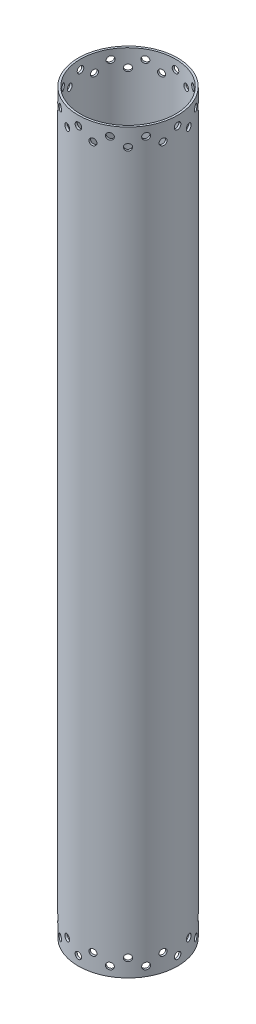
from build123d import *

# Parameters (mm, degrees)
SKETCH2_R                = 76.2
SKETCH2_R_2              = 73.025
BOSS_EXTRUDE1_DEPTH      = 1130.3
SKETCH3_R                = 5.0419
CUT_EXTRUDE1_DEPTH       = 1143
SKETCH6_R                = 5.0419
CUT_EXTRUDE2_DEPTH       = 25.4
CIRPATTERN2_COUNT        = 12
MIRROR1_COPY_1_SKETCH_R  = 5.0419
MIRROR1_COPY_1_DEPTH     = 1143
MIRROR1_COPY_2_SKETCH_R  = 5.0419
MIRROR1_COPY_2_DEPTH     = 1143
MIRROR1_COPY_3_SKETCH_R  = 5.0419
MIRROR1_COPY_3_DEPTH     = 1143
MIRROR1_COPY_4_SKETCH_R  = 5.0419
MIRROR1_COPY_4_DEPTH     = 1143
MIRROR1_COPY_5_SKETCH_R  = 5.0419
MIRROR1_COPY_5_DEPTH     = 1143
MIRROR1_COPY_6_SKETCH_R  = 5.0419
MIRROR1_COPY_6_DEPTH     = 1143
MIRROR1_COPY_7_SKETCH_R  = 5.0419
MIRROR1_COPY_7_DEPTH     = 1143
MIRROR1_COPY_8_SKETCH_R  = 5.0419
MIRROR1_COPY_8_DEPTH     = 1143
MIRROR1_COPY_9_SKETCH_R  = 5.0419
MIRROR1_COPY_9_DEPTH     = 1143
MIRROR1_COPY_10_SKETCH_R = 5.0419
MIRROR1_COPY_10_DEPTH    = 1143
MIRROR1_COPY_11_SKETCH_R = 5.0419
MIRROR1_COPY_11_DEPTH    = 1143
MIRROR1_COPY_12_SKETCH_R = 5.0419
MIRROR1_COPY_12_DEPTH    = 25.4
MIRROR1_COPY_13_SKETCH_R = 5.0419
MIRROR1_COPY_13_DEPTH    = 25.4
MIRROR1_COPY_14_SKETCH_R = 5.0419
MIRROR1_COPY_14_DEPTH    = 25.4
MIRROR1_COPY_15_SKETCH_R = 5.0419
MIRROR1_COPY_15_DEPTH    = 25.4
MIRROR1_COPY_16_SKETCH_R = 5.0419
MIRROR1_COPY_16_DEPTH    = 25.4
MIRROR1_COPY_17_SKETCH_R = 5.0419
MIRROR1_COPY_17_DEPTH    = 25.4
MIRROR1_COPY_18_SKETCH_R = 5.0419
MIRROR1_COPY_18_DEPTH    = 25.4
MIRROR1_COPY_19_SKETCH_R = 5.0419
MIRROR1_COPY_19_DEPTH    = 25.4
MIRROR1_COPY_20_SKETCH_R = 5.0419
MIRROR1_COPY_20_DEPTH    = 25.4
MIRROR1_COPY_21_SKETCH_R = 5.0419
MIRROR1_COPY_21_DEPTH    = 25.4
MIRROR1_COPY_22_SKETCH_R = 5.0419
MIRROR1_COPY_22_DEPTH    = 25.4
MIRROR1_COPY_23_SKETCH_R = 5.0419
MIRROR1_COPY_23_DEPTH    = 1143
MIRROR1_COPY_24_SKETCH_R = 5.0419
MIRROR1_COPY_24_DEPTH    = 25.4


with BuildPart() as part:
    # Sketch2 → Boss-Extrude1 (new body)
    with BuildSketch(Plane(origin=(0, 0, 0), x_dir=(1, 0, 0), z_dir=(0, 1, 0))):
        Circle(SKETCH2_R)
        Circle(SKETCH2_R_2, mode=Mode.SUBTRACT)
    extrude(amount=BOSS_EXTRUDE1_DEPTH)

    # Sketch3 → Cut-Extrude1 (cut)
    with BuildSketch(Plane.XY):
        with Locations((0, 1116.203)):
            Circle(SKETCH3_R)
    cut_extrude1 = extrude(amount=-CUT_EXTRUDE1_DEPTH, mode=Mode.SUBTRACT)

    # Sketch6 → Cut-Extrude2 (cut)
    with BuildSketch(Plane(origin=(-19.722011237, 0, 73.603547963), x_dir=(0, -1, 0), z_dir=(-0.25881904510252135, 0, 0.9659258262890681))):
        with Locations((-1103.503, 0)):
            Circle(SKETCH6_R)
    cut_extrude2 = extrude(amount=-CUT_EXTRUDE2_DEPTH, mode=Mode.SUBTRACT)

    # CirPattern2: Cut-Extrude1, Cut-Extrude2 ×12 about axis
    cirpattern2_axis = Axis((0, 1130.3, 0), (0, -1, 0))
    add([cut_extrude1.rotate(cirpattern2_axis, i * 360 / CIRPATTERN2_COUNT) for i in range(1, CIRPATTERN2_COUNT)], mode=Mode.SUBTRACT)
    add([cut_extrude2.rotate(cirpattern2_axis, i * 360 / CIRPATTERN2_COUNT) for i in range(1, CIRPATTERN2_COUNT)], mode=Mode.SUBTRACT)

    # Mirror1 copy 1 sketch → Mirror1 copy 1 (cut)
    with BuildSketch(Plane(origin=(0, 1130.3, 0), x_dir=(0.8660254037844387, 0, 0.49999999999999994), z_dir=(-0.49999999999999994, 0, 0.8660254037844387))):
        with Locations((0, -1116.203)):
            Circle(MIRROR1_COPY_1_SKETCH_R)
    extrude(amount=-MIRROR1_COPY_1_DEPTH, mode=Mode.SUBTRACT)

    # Mirror1 copy 2 sketch → Mirror1 copy 2 (cut)
    with BuildSketch(Plane(origin=(0, 1130.3, 0), x_dir=(0.5000000000000001, 0, 0.8660254037844386), z_dir=(-0.8660254037844386, 0, 0.5000000000000001))):
        with Locations((0, -1116.203)):
            Circle(MIRROR1_COPY_2_SKETCH_R)
    extrude(amount=-MIRROR1_COPY_2_DEPTH, mode=Mode.SUBTRACT)

    # Mirror1 copy 3 sketch → Mirror1 copy 3 (cut)
    with BuildSketch(Plane(origin=(0, 1130.3, 0), x_dir=(0, 0, 1), z_dir=(-1, 0, 0))):
        with Locations((0, -1116.203)):
            Circle(MIRROR1_COPY_3_SKETCH_R)
    extrude(amount=-MIRROR1_COPY_3_DEPTH, mode=Mode.SUBTRACT)

    # Mirror1 copy 4 sketch → Mirror1 copy 4 (cut)
    with BuildSketch(Plane(origin=(0, 1130.3, 0), x_dir=(-0.4999999999999998, 0, 0.8660254037844387), z_dir=(-0.8660254037844387, 0, -0.4999999999999998))):
        with Locations((0, -1116.203)):
            Circle(MIRROR1_COPY_4_SKETCH_R)
    extrude(amount=-MIRROR1_COPY_4_DEPTH, mode=Mode.SUBTRACT)

    # Mirror1 copy 5 sketch → Mirror1 copy 5 (cut)
    with BuildSketch(Plane(origin=(0, 1130.3, 0), x_dir=(-0.8660254037844387, 0, 0.49999999999999994), z_dir=(-0.49999999999999994, 0, -0.8660254037844387))):
        with Locations((0, -1116.203)):
            Circle(MIRROR1_COPY_5_SKETCH_R)
    extrude(amount=-MIRROR1_COPY_5_DEPTH, mode=Mode.SUBTRACT)

    # Mirror1 copy 6 sketch → Mirror1 copy 6 (cut)
    with BuildSketch(Plane(origin=(0, 1130.3, 0), x_dir=(-1, 0, 0), z_dir=(0, 0, -1))):
        with Locations((0, -1116.203)):
            Circle(MIRROR1_COPY_6_SKETCH_R)
    extrude(amount=-MIRROR1_COPY_6_DEPTH, mode=Mode.SUBTRACT)

    # Mirror1 copy 7 sketch → Mirror1 copy 7 (cut)
    with BuildSketch(Plane(origin=(0, 1130.3, 0), x_dir=(-0.8660254037844386, 0, -0.5000000000000001), z_dir=(0.5000000000000001, 0, -0.8660254037844386))):
        with Locations((0, -1116.203)):
            Circle(MIRROR1_COPY_7_SKETCH_R)
    extrude(amount=-MIRROR1_COPY_7_DEPTH, mode=Mode.SUBTRACT)

    # Mirror1 copy 8 sketch → Mirror1 copy 8 (cut)
    with BuildSketch(Plane(origin=(0, 1130.3, 0), x_dir=(-0.5000000000000004, 0, -0.8660254037844384), z_dir=(0.8660254037844384, 0, -0.5000000000000004))):
        with Locations((0, -1116.203)):
            Circle(MIRROR1_COPY_8_SKETCH_R)
    extrude(amount=-MIRROR1_COPY_8_DEPTH, mode=Mode.SUBTRACT)

    # Mirror1 copy 9 sketch → Mirror1 copy 9 (cut)
    with BuildSketch(Plane(origin=(0, 1130.3, 0), x_dir=(0, 0, -1), z_dir=(1, 0, 0))):
        with Locations((0, -1116.203)):
            Circle(MIRROR1_COPY_9_SKETCH_R)
    extrude(amount=-MIRROR1_COPY_9_DEPTH, mode=Mode.SUBTRACT)

    # Mirror1 copy 10 sketch → Mirror1 copy 10 (cut)
    with BuildSketch(Plane(origin=(0, 1130.3, 0), x_dir=(0.5000000000000001, 0, -0.8660254037844386), z_dir=(0.8660254037844386, 0, 0.5000000000000001))):
        with Locations((0, -1116.203)):
            Circle(MIRROR1_COPY_10_SKETCH_R)
    extrude(amount=-MIRROR1_COPY_10_DEPTH, mode=Mode.SUBTRACT)

    # Mirror1 copy 11 sketch → Mirror1 copy 11 (cut)
    with BuildSketch(Plane(origin=(0, 1130.3, 0), x_dir=(0.8660254037844384, 0, -0.5000000000000004), z_dir=(0.5000000000000004, 0, 0.8660254037844384))):
        with Locations((0, -1116.203)):
            Circle(MIRROR1_COPY_11_SKETCH_R)
    extrude(amount=-MIRROR1_COPY_11_DEPTH, mode=Mode.SUBTRACT)

    # Mirror1 copy 12 sketch → Mirror1 copy 12 (cut)
    with BuildSketch(Plane(origin=(-53.881536726, 1130.3, 53.881536726), x_dir=(0, 1, 0), z_dir=(-0.7071067811865479, 0, 0.7071067811865472))):
        with Locations((-1103.503, 0)):
            Circle(MIRROR1_COPY_12_SKETCH_R)
    extrude(amount=-MIRROR1_COPY_12_DEPTH, mode=Mode.SUBTRACT)

    # Mirror1 copy 13 sketch → Mirror1 copy 13 (cut)
    with BuildSketch(Plane(origin=(-73.603547963, 1130.3, 19.722011237), x_dir=(0, 1, 0), z_dir=(-0.9659258262890684, 0, 0.2588190451025203))):
        with Locations((-1103.503, 0)):
            Circle(MIRROR1_COPY_13_SKETCH_R)
    extrude(amount=-MIRROR1_COPY_13_DEPTH, mode=Mode.SUBTRACT)

    # Mirror1 copy 14 sketch → Mirror1 copy 14 (cut)
    with BuildSketch(Plane(origin=(-73.603547963, 1130.3, -19.722011237), x_dir=(0, 1, 0), z_dir=(-0.9659258262890681, 0, -0.2588190451025213))):
        with Locations((-1103.503, 0)):
            Circle(MIRROR1_COPY_14_SKETCH_R)
    extrude(amount=-MIRROR1_COPY_14_DEPTH, mode=Mode.SUBTRACT)

    # Mirror1 copy 15 sketch → Mirror1 copy 15 (cut)
    with BuildSketch(Plane(origin=(-53.881536726, 1130.3, -53.881536726), x_dir=(0, 1, 0), z_dir=(-0.7071067811865472, 0, -0.7071067811865477))):
        with Locations((-1103.503, 0)):
            Circle(MIRROR1_COPY_15_SKETCH_R)
    extrude(amount=-MIRROR1_COPY_15_DEPTH, mode=Mode.SUBTRACT)

    # Mirror1 copy 16 sketch → Mirror1 copy 16 (cut)
    with BuildSketch(Plane(origin=(-19.722011237, 1130.3, -73.603547963), x_dir=(0, 1, 0), z_dir=(-0.2588190451025201, 0, -0.9659258262890684))):
        with Locations((-1103.503, 0)):
            Circle(MIRROR1_COPY_16_SKETCH_R)
    extrude(amount=-MIRROR1_COPY_16_DEPTH, mode=Mode.SUBTRACT)

    # Mirror1 copy 17 sketch → Mirror1 copy 17 (cut)
    with BuildSketch(Plane(origin=(19.722011237, 1130.3, -73.603547963), x_dir=(0, 1, 0), z_dir=(0.25881904510252124, 0, -0.9659258262890681))):
        with Locations((-1103.503, 0)):
            Circle(MIRROR1_COPY_17_SKETCH_R)
    extrude(amount=-MIRROR1_COPY_17_DEPTH, mode=Mode.SUBTRACT)

    # Mirror1 copy 18 sketch → Mirror1 copy 18 (cut)
    with BuildSketch(Plane(origin=(53.881536726, 1130.3, -53.881536726), x_dir=(0, 1, 0), z_dir=(0.707106781186548, 0, -0.707106781186547))):
        with Locations((-1103.503, 0)):
            Circle(MIRROR1_COPY_18_SKETCH_R)
    extrude(amount=-MIRROR1_COPY_18_DEPTH, mode=Mode.SUBTRACT)

    # Mirror1 copy 19 sketch → Mirror1 copy 19 (cut)
    with BuildSketch(Plane(origin=(73.603547963, 1130.3, -19.722011237), x_dir=(0, 1, 0), z_dir=(0.9659258262890683, 0, -0.25881904510252063))):
        with Locations((-1103.503, 0)):
            Circle(MIRROR1_COPY_19_SKETCH_R)
    extrude(amount=-MIRROR1_COPY_19_DEPTH, mode=Mode.SUBTRACT)

    # Mirror1 copy 20 sketch → Mirror1 copy 20 (cut)
    with BuildSketch(Plane(origin=(73.603547963, 1130.3, 19.722011237), x_dir=(0, 1, 0), z_dir=(0.9659258262890681, 0, 0.2588190451025212))):
        with Locations((-1103.503, 0)):
            Circle(MIRROR1_COPY_20_SKETCH_R)
    extrude(amount=-MIRROR1_COPY_20_DEPTH, mode=Mode.SUBTRACT)

    # Mirror1 copy 21 sketch → Mirror1 copy 21 (cut)
    with BuildSketch(Plane(origin=(53.881536726, 1130.3, 53.881536726), x_dir=(0, 1, 0), z_dir=(0.707106781186547, 0, 0.707106781186548))):
        with Locations((-1103.503, 0)):
            Circle(MIRROR1_COPY_21_SKETCH_R)
    extrude(amount=-MIRROR1_COPY_21_DEPTH, mode=Mode.SUBTRACT)

    # Mirror1 copy 22 sketch → Mirror1 copy 22 (cut)
    with BuildSketch(Plane(origin=(19.722011237, 1130.3, 73.603547963), x_dir=(0, 1, 0), z_dir=(0.25881904510252063, 0, 0.9659258262890683))):
        with Locations((-1103.503, 0)):
            Circle(MIRROR1_COPY_22_SKETCH_R)
    extrude(amount=-MIRROR1_COPY_22_DEPTH, mode=Mode.SUBTRACT)

    # Mirror1 copy 23 sketch → Mirror1 copy 23 (cut)
    with BuildSketch(Plane(origin=(0, 1130.3, 0), x_dir=(1, 0, 0), z_dir=(0, 0, 1))):
        with Locations((0, -1116.203)):
            Circle(MIRROR1_COPY_23_SKETCH_R)
    extrude(amount=-MIRROR1_COPY_23_DEPTH, mode=Mode.SUBTRACT)

    # Mirror1 copy 24 sketch → Mirror1 copy 24 (cut)
    with BuildSketch(Plane(origin=(-19.722011237, 1130.3, 73.603547963), x_dir=(0, 1, 0), z_dir=(-0.25881904510252135, 0, 0.9659258262890681))):
        with Locations((-1103.503, 0)):
            Circle(MIRROR1_COPY_24_SKETCH_R)
    extrude(amount=-MIRROR1_COPY_24_DEPTH, mode=Mode.SUBTRACT)


solid = part.part
